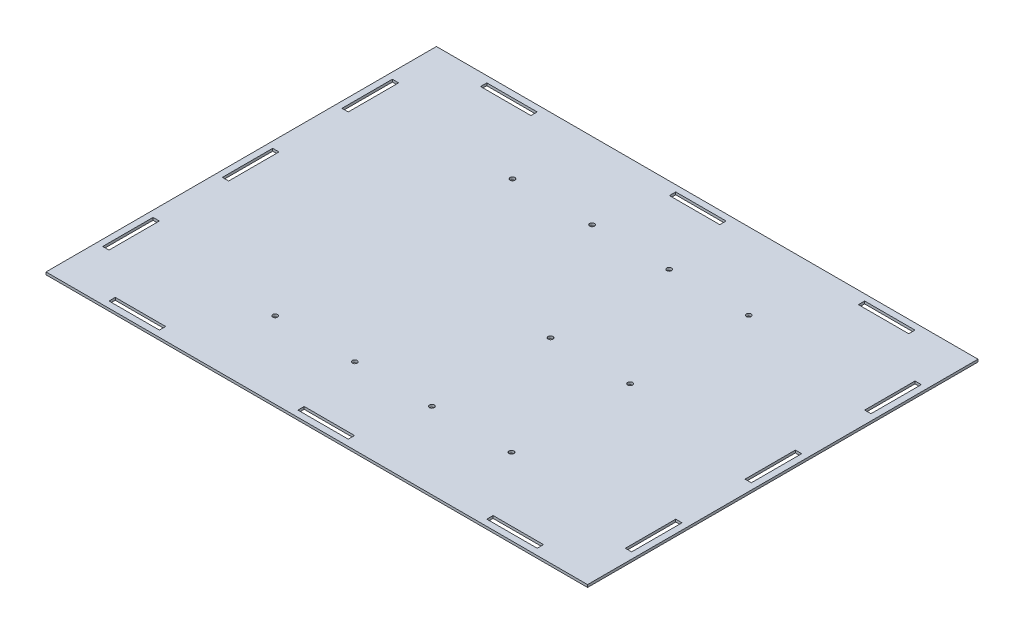
from build123d import *

# Parameters (mm, degrees)
BOSS_EXTRUDE1_DEPTH         = 2.54
F_11_0_191_DIAMETER_HOLE2_D = 4.8514
F_11_0_191_DIAMETER_HOLE3_D = 4.8514
SKETCH17_W                  = 6.35
SKETCH17_H                  = 50.8
SKETCH17_W_2                = 50.8
SKETCH17_H_2                = 6.35
SKETCH17_H_3                = 25.4
CUT_EXTRUDE12_DEPTH         = 304.883162745


with BuildPart() as part:
    # Sketch1 → Boss-Extrude1 (new body)
    with BuildSketch(Plane(origin=(0, 0, 0), x_dir=(1, 0, 0), z_dir=(0, 1, 0))):
        Polygon((0, 63.5), (-273.05, 63.5), (-273.05, -63.5), (-273.05, -133.35), (273.05, -133.35), (273.05, -63.5), (273.05, 63.5), align=None)
    boss_extrude1 = extrude(amount=BOSS_EXTRUDE1_DEPTH)

    # #11 (0.191) Diameter Hole2 (through all)
    with Locations(Plane(origin=(0, 2.54, 0), x_dir=(1, 0, 0), z_dir=(0, 1, 0))):
        with Locations((-119.126, -56.127777467), (-38.862, -56.127777467), (38.862, -56.127777467), (119.126, -56.127777467)):
            f_11_0_191_diameter_hole2 = Hole(F_11_0_191_DIAMETER_HOLE2_D / 2)

    # #11 (0.191) Diameter Hole3 (through all)
    with Locations(Plane(origin=(0, 2.54, 0), x_dir=(1, 0, 0), z_dir=(0, 1, 0))):
        with Locations((119.126, 63.5), (38.862, 63.5)):
            f_11_0_191_diameter_hole3 = Hole(F_11_0_191_DIAMETER_HOLE3_D / 2)

    # Sketch17 → Cut-Extrude12 (cut, through all)
    with BuildSketch(Plane(origin=(0, 2.54, 0), x_dir=(1, 0, 0), z_dir=(0, 1, 0))):
        with Locations((-263.525, -57.15)):
            Rectangle(SKETCH17_W, SKETCH17_H)
        with Locations((-190.5, -123.825)):
            Rectangle(SKETCH17_W_2, SKETCH17_H_2)
        with Locations((190.5, -123.825)):
            Rectangle(SKETCH17_W_2, SKETCH17_H_2)
        with Locations((263.525, -57.15)):
            Rectangle(SKETCH17_W, SKETCH17_H)
        with Locations((0, -123.825)):
            Rectangle(SKETCH17_W_2, SKETCH17_H_2)
        with Locations((-263.525, 50.8)):
            Rectangle(SKETCH17_W, SKETCH17_H_3)
        with Locations((263.525, 50.8)):
            Rectangle(SKETCH17_W, SKETCH17_H_3)
    cut_extrude12 = extrude(amount=-CUT_EXTRUDE12_DEPTH, mode=Mode.SUBTRACT)

    # Mirror1: Boss-Extrude1, #11 (0.191) Diameter Hole2, #11 (0.191) Diameter Hole3, Cut-Extrude12 across plane
    add(boss_extrude1.mirror(Plane(origin=(0, 2.54, -63.5), x_dir=(1, 0, 0), z_dir=(0, 0, -1))))
    add(f_11_0_191_diameter_hole2.mirror(Plane(origin=(0, 2.54, -63.5), x_dir=(1, 0, 0), z_dir=(0, 0, -1))), mode=Mode.SUBTRACT)
    add(f_11_0_191_diameter_hole3.mirror(Plane(origin=(0, 2.54, -63.5), x_dir=(1, 0, 0), z_dir=(0, 0, -1))), mode=Mode.SUBTRACT)
    add(cut_extrude12.mirror(Plane(origin=(0, 2.54, -63.5), x_dir=(1, 0, 0), z_dir=(0, 0, -1))), mode=Mode.SUBTRACT)


solid = part.part
